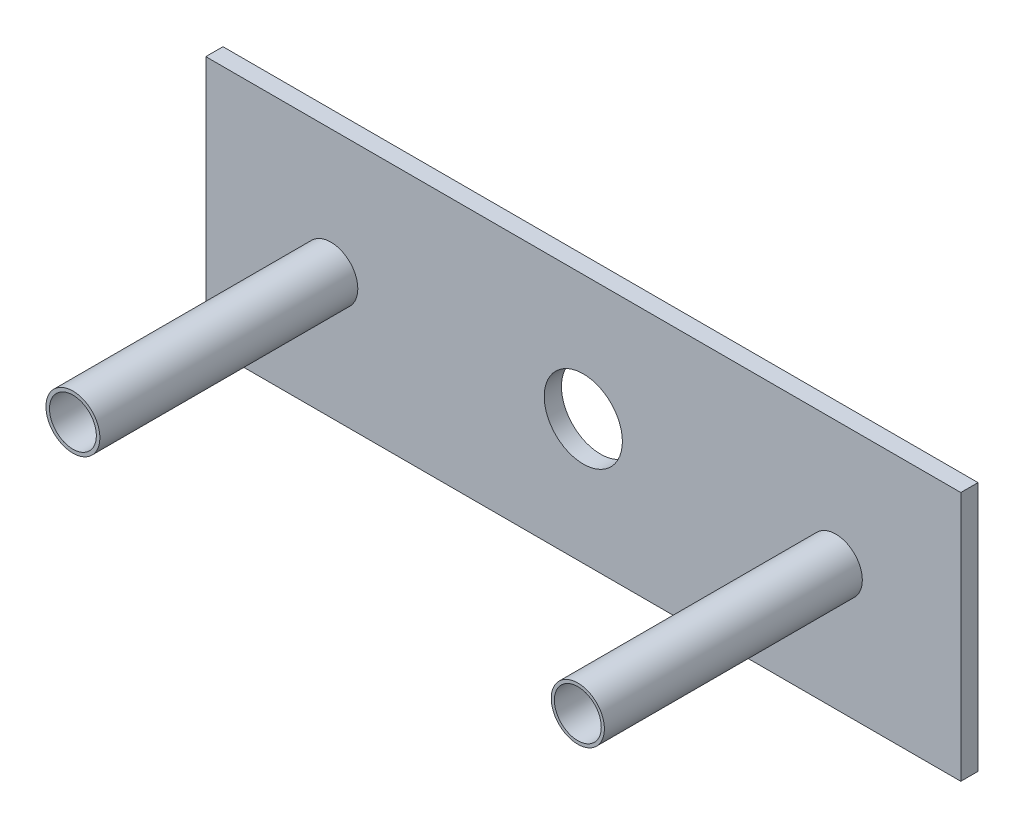
from build123d import *

# Parameters (mm, degrees)
ESQUISSE1_W             = 96.6
ESQUISSE1_H             = 32
BOSS_EXTRU_1_DEPTH      = 2.2
ESQUISSE6_R             = 3.45
ESQUISSE6_R_2           = 3.4
BOSS_EXTRU_2_DEPTH      = 33
ESQUISSE7_R             = 3
ESQUISSE7_R_2           = 5
ENL_V_MAT_EXTRU_1_DEPTH = 64.013010851


with BuildPart() as part:
    # Esquisse1 → Boss.-Extru.1 (new body)
    with BuildSketch(Plane.XY):
        with Locations((0.671156739, 2.259938231)):
            Rectangle(ESQUISSE1_W, ESQUISSE1_H)
    extrude(amount=BOSS_EXTRU_1_DEPTH)

    # Esquisse6 → Boss.-Extru.2 (add)
    with BuildSketch(Plane.XY.offset(2.2)):
        with Locations((-31.628843261, 2.259938231)):
            Circle(ESQUISSE6_R)
        with Locations((32.971156739, 2.259938231)):
            Circle(ESQUISSE6_R_2)
    extrude(amount=BOSS_EXTRU_2_DEPTH)

    # Esquisse7 → Enlèv. mat.-Extru.1 (cut, through all)
    with BuildSketch(Plane.XY.offset(35.2)):
        with Locations((-31.628843261, 2.259938231)):
            Circle(ESQUISSE7_R)
        with Locations((32.971156739, 2.259938231)):
            Circle(ESQUISSE7_R)
        with Locations((0.671156739, 2.259938231)):
            Circle(ESQUISSE7_R_2)
    extrude(amount=-ENL_V_MAT_EXTRU_1_DEPTH, mode=Mode.SUBTRACT)


solid = part.part
